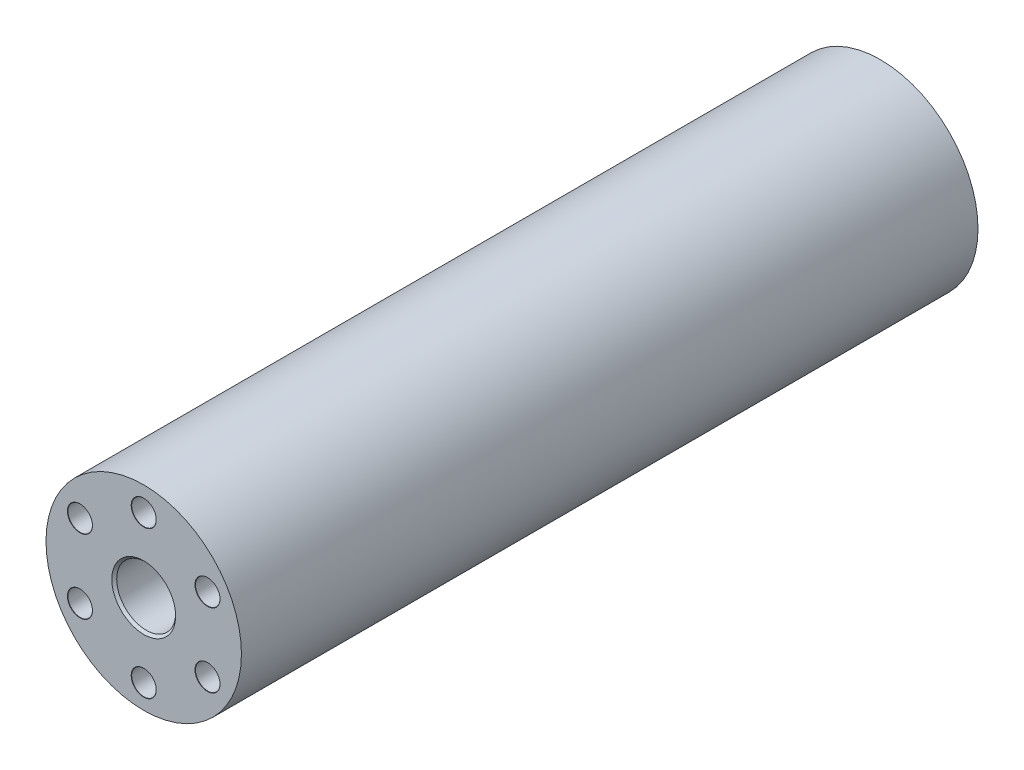
from build123d import *

# Parameters (mm, degrees)
SKETCH1_R                         = 9.95
BOSS_EXTRUDE1_DEPTH               = 75
TAP_DRILL_FOR_M3_TAP1_D           = 2.5
TAP_DRILL_FOR_M3_TAP1_DEPTH       = 10
TAP_DRILL_FOR_M3_TAP1_CSINK_D     = 2.55
TAP_DRILL_FOR_M3_TAP1_CSINK_ANGLE = 90
TAP_DRILL_FOR_M3_TAP1_TIP         = 0.751075774
TAP_DRILL_FOR_M3_TAP2_D           = 2.5
TAP_DRILL_FOR_M3_TAP2_DEPTH       = 10
TAP_DRILL_FOR_M3_TAP2_CSINK_D     = 2.55
TAP_DRILL_FOR_M3_TAP2_CSINK_ANGLE = 90
TAP_DRILL_FOR_M3_TAP2_TIP         = 0.751075774


with BuildPart() as part:
    # Sketch1 → Boss-Extrude1 (new body)
    with BuildSketch(Plane.XY):
        Circle(SKETCH1_R)
    extrude(amount=BOSS_EXTRUDE1_DEPTH)

    # Sketch4 → Ø6.0mm Dowel Hole1 (revolve, cut)
    with BuildSketch(Plane.YZ):
        Polygon((0, 0), (0, 75), (3.25, 75), (3, 74.75), (3, 0.25), (3.25, 0), align=None)
    revolve(axis=Axis((0, 0, -6.35), (0, 0, 1)), mode=Mode.SUBTRACT)

    # Tap Drill for M3 Tap1
    with Locations(Plane(origin=(0, 0, 0), x_dir=(-1, 0, 0), z_dir=(0, 0, -1))):
        with Locations((-6.062177826, -3.5), (0, 7), (6.062177826, -3.5)):
            CounterSinkHole(TAP_DRILL_FOR_M3_TAP1_D / 2, TAP_DRILL_FOR_M3_TAP1_CSINK_D / 2, depth=TAP_DRILL_FOR_M3_TAP1_DEPTH, counter_sink_angle=TAP_DRILL_FOR_M3_TAP1_CSINK_ANGLE)
            with Locations((0, 0, -(TAP_DRILL_FOR_M3_TAP1_DEPTH + TAP_DRILL_FOR_M3_TAP1_TIP / 2))):  # 118° drill point
                Cone(0, TAP_DRILL_FOR_M3_TAP1_D / 2, TAP_DRILL_FOR_M3_TAP1_TIP, mode=Mode.SUBTRACT)

    # Tap Drill for M3 Tap2
    with Locations(Plane.XY.offset(75)):
        with Locations((-6.495190528, 3.75), (0, 7.5), (6.495190528, 3.75), (6.495190528, -3.75), (0, -7.5), (-6.495190528, -3.75)):
            CounterSinkHole(TAP_DRILL_FOR_M3_TAP2_D / 2, TAP_DRILL_FOR_M3_TAP2_CSINK_D / 2, depth=TAP_DRILL_FOR_M3_TAP2_DEPTH, counter_sink_angle=TAP_DRILL_FOR_M3_TAP2_CSINK_ANGLE)
            with Locations((0, 0, -(TAP_DRILL_FOR_M3_TAP2_DEPTH + TAP_DRILL_FOR_M3_TAP2_TIP / 2))):  # 118° drill point
                Cone(0, TAP_DRILL_FOR_M3_TAP2_D / 2, TAP_DRILL_FOR_M3_TAP2_TIP, mode=Mode.SUBTRACT)


solid = part.part
